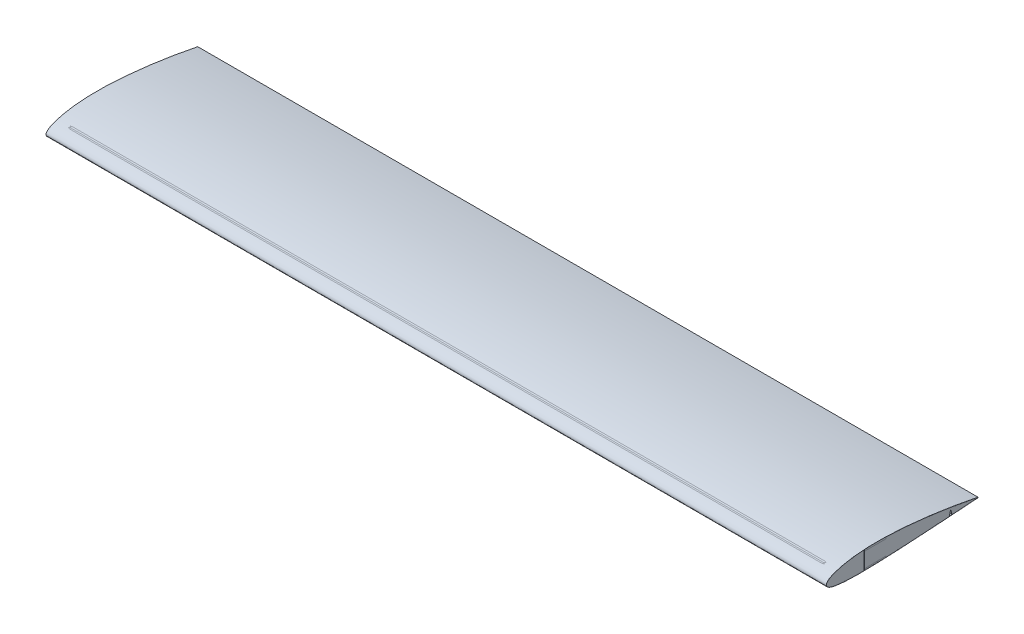
from build123d import *

# Parameters (mm, degrees)
BOSS_EXTRUDE1_DEPTH      = 914.4
SPLIT1_SURFACE_1_1_BACK  = 1864.333
SPLIT1_SURFACE_1_1_DEPTH = 3728.666
SPLIT1_SURFACE_1_2_BACK  = 1864.333
SPLIT1_SURFACE_1_2_DEPTH = 3728.666
SPLIT1_SURFACE_2_3_BACK  = 1864.333
SPLIT1_SURFACE_2_3_DEPTH = 3728.666
SPLIT1_SURFACE_2_4_BACK  = 1864.333
SPLIT1_SURFACE_2_4_DEPTH = 3728.666
CUT_EXTRUDE2_DEPTH       = 1864.047955072
CUT_EXTRUDE2_DEPTH_BACK  = 1864.047955072
SKETCH5_W                = 0.6096
SKETCH5_H                = 41.97587398
BOSS_EXTRUDE3_DEPTH      = 914.4
CUT_EXTRUDE1_DEPTH       = 982.342251229
CUT_EXTRUDE1_DEPTH_BACK  = 982.342251229
CUT_EXTRUDE3_START       = -15.24
SKETCH7_W                = 88.9
SKETCH7_H                = 50.8
SKETCH7_W_2              = 70
SKETCH7_H_2              = 60
CUT_EXTRUDE3_DEPTH       = 30


with BuildPart() as part:
    # Sketch3 → Boss-Extrude1 (new, symmetric)
    with BuildSketch(Plane(origin=(0, 0, 0), x_dir=(0, 0, -1), z_dir=(1, 0, 0))):
        with BuildLine():
            Line((354.482395792, 0.088620593), (354.482404208, -0.088620593))
            add(Edge.make_bspline(
                [(354.482395792, 0.088620593), (352.608228452, 0.482962912), (348.863032635, 1.270987104), (343.239204367, 2.400705172), (337.619234196, 3.501205803), (332.00350741, 4.57336723), (326.39365094, 5.621708723), (320.790955975, 6.647898692), (313.3412437, 7.986206456), (302.217548708, 9.927124821), (289.282248172, 12.069306379), (276.418289617, 14.074375479), (265.490213834, 15.689685159), (251.115583129, 17.697647921), (236.873997635, 19.516706822), (222.782191073, 21.1545078), (212.410278806, 22.282196191), (202.181522544, 23.317263374), (192.106178265, 24.258738007), (182.194355765, 25.104010981), (172.455993609, 25.84914195), (161.366752116, 26.592136123), (149.021873138, 27.260173986), (135.523535242, 27.752901504), (122.520585026, 27.971703259), (110.042618811, 27.912632335), (99.358952427, 27.613925108), (90.383015498, 27.176611302), (83.018255857, 26.691704891), (75.92680001, 26.098801968), (69.115792956, 25.403560206), (62.592086687, 24.612075224), (56.362219308, 23.730740073), (50.432432253, 22.76613435), (44.808681252, 21.725005613), (39.496589414, 20.614286523), (35.273389174, 19.622414223), (31.312122611, 18.607678857), (28.30479813, 17.772072592), (25.414040275, 16.897477013), (23.365017286, 16.242283662), (21.399313086, 15.577802598), (19.517418849, 14.904921007), (17.719798231, 14.224519318), (16.006896794, 13.537442329), (14.379132199, 12.844514757), (12.83689884, 12.146526839), (11.380573945, 11.444212218), (10.010495431, 10.738285126), (8.72699723, 10.029363811), (7.530365935, 9.318048232), (6.420876343, 8.604847497), (5.398771977, 7.890203754), (4.464271107, 7.174487774), (3.617571137, 6.457983471), (2.858851273, 5.740891979), (2.188290996, 5.02331412), (1.606069933, 4.305271505), (1.112414132, 3.586696787), (0.707594428, 2.867468864), (0.392035275, 2.147467241), (0.165980955, 1.426648517), (0.03064104, 0.705108282), (-0.015062322, 0.002321998), (0.0300091, -0.681067808), (0.166233189, -1.342726293), (0.392064116, -1.999419221), (0.707750679, -2.648952207), (1.11267333, -3.289391709), (1.606518652, -3.919009399), (2.188985401, -4.536239368), (2.859837198, -5.139669278), (3.618875057, -5.728012998), (4.465910314, -6.300126202), (5.400751117, -6.855005762), (6.423189663, -7.391813529), (7.532996553, -7.909871987), (8.729927186, -8.408651764), (10.013701883, -8.887797325), (11.38402716, -9.347075258), (12.840573178, -9.786424712), (14.382996464, -10.205871846), (16.010922843, -10.605571954), (17.723957882, -10.985755667), (19.521682855, -11.346729932), (21.403657483, -11.688838297), (23.369418393, -12.012454984), (25.418477351, -12.317982315), (27.550327067, -12.60579833), (29.764437774, -12.876267774), (32.06025868, -13.129726833), (35.281637131, -13.450564772), (39.508953014, -13.807595259), (44.820372176, -14.165273739), (50.443395574, -14.459314626), (56.372426035, -14.689735484), (62.601520751, -14.856376302), (69.124436068, -14.959259527), (75.934620245, -14.999005808), (83.025208132, -14.977114302), (90.389050421, -14.896168064), (98.01873047, -14.759786253), (105.906589977, -14.572414932), (114.044705159, -14.338950875), (122.424896468, -14.064247122), (131.038747414, -13.752531546), (139.877603076, -13.406970238), (148.932577206, -13.029259309), (161.41234267, -12.47716831), (174.14861492, -11.863755741), (187.128161714, -11.181855227), (197.122814271, -10.626100485), (207.275853505, -10.030722137), (219.334002974, -9.289918707), (231.549233078, -8.503762909), (243.909719078, -7.688473483), (254.646983505, -6.974941746), (263.659566191, -6.37740606), (272.749168182, -5.777991417), (281.906666981, -5.177313299), (292.948412975, -4.453461563), (302.190318, -3.838787226), (309.611800723, -3.332601249), (315.195965568, -2.943756386), (320.789989327, -2.54505907), (326.392440618, -2.136294162), (332.001878993, -1.718848953), (337.616855999, -1.295823565), (343.235982568, -0.874824171), (348.857573789, -0.461772871), (352.607516747, -0.21300097), (354.482404208, -0.088620593)],
                knots=[0, 0, 0, 0, 0.007940543, 0.015867786, 0.023782336, 0.031683842, 0.039571466, 0.047443805, 0.055299407, 0.070952907, 0.094259966, 0.109659749, 0.124931368, 0.140060475, 0.169836167, 0.184455938, 0.198878988, 0.213091981, 0.227081364, 0.240833733, 0.254335896, 0.267574898, 0.286913018, 0.305591757, 0.323574751, 0.340828862, 0.357323531, 0.367884026, 0.378086462, 0.387923234, 0.397387015, 0.406470797, 0.41516795, 0.423472244, 0.43137777, 0.438879022, 0.445971139, 0.449362331, 0.455832514, 0.458910652, 0.461883669, 0.464751272, 0.467513247, 0.470169459, 0.472719872, 0.475164567, 0.477503762, 0.479737826, 0.481867333, 0.483893084, 0.485816152, 0.487637951, 0.489360303, 0.49098553, 0.492516542, 0.493957004, 0.495311466, 0.496585561, 0.4977862, 0.498921787, 0.500002352, 0.50103964, 0.502046987, 0.503038995, 0.503951731, 0.504878158, 0.505831393, 0.506823576, 0.507865603, 0.508967032, 0.510136107, 0.511379885, 0.512704371, 0.51411466, 0.515615093, 0.517209348, 0.518900571, 0.520691419, 0.522584144, 0.524580638, 0.526682478, 0.528890964, 0.531207133, 0.533631806, 0.536165599, 0.538808937, 0.541562081, 0.544425147, 0.547398108, 0.550480817, 0.553673027, 0.556974385, 0.563902733, 0.571261381, 0.579045037, 0.58724742, 0.595861595, 0.604880098, 0.614294871, 0.624097261, 0.634278056, 0.644827522, 0.655735355, 0.666990799, 0.678582536, 0.690498843, 0.702727789, 0.715257042, 0.728074047, 0.754520377, 0.768123571, 0.781962351, 0.796022904, 0.810291085, 0.832050541, 0.846772874, 0.861649926, 0.876666219, 0.884221743, 0.899417941, 0.914715475, 0.9300999, 0.937820202, 0.945556969, 0.953308312, 0.961072259, 0.968846879, 0.976629764, 0.984418334, 0.992209516, 1, 1, 1, 1], degree=3))
        make_face()
    extrude(amount=BOSS_EXTRUDE1_DEPTH, both=True)


with BuildPart() as body_2:
    # Split1: the piece behind the surface
    add(part.part)
    # Split1 surface 1: a surface, the sketch's curves swept straight by 3728.666 mm
    with BuildLine(Plane(origin=(914.4, 0, 0), x_dir=(0, 0, -1), z_dir=(1, 0, 0)).offset(-SPLIT1_SURFACE_1_1_BACK), mode=Mode.PRIVATE) as split1_surface_1_1_path:
        Line((139.692248422, -14.02064701), (139.692248422, -10.84564701))
        Line((139.692248422, -10.84564701), (88.9, -11.733059128))
        Line((88.9, -11.733059128), (88.9, -14.908059128))
    split1_surface_1_1 = Shell.extrude(split1_surface_1_1_path.wire(), (1 * SPLIT1_SURFACE_1_1_DEPTH, 0 * SPLIT1_SURFACE_1_1_DEPTH, 0 * SPLIT1_SURFACE_1_1_DEPTH))
    split(bisect_by=split1_surface_1_1, keep=Keep.BOTTOM)


with BuildPart() as part_1:
    add(part.part)

    # Split1: split by a surface, the side it looks to stays
    # Split1 surface 1: a surface, the sketch's curves swept straight by 3728.666 mm
    with BuildLine(Plane(origin=(914.4, 0, 0), x_dir=(0, 0, -1), z_dir=(1, 0, 0)).offset(-SPLIT1_SURFACE_1_2_BACK), mode=Mode.PRIVATE) as split1_surface_1_2_path:
        Line((139.692248422, -14.02064701), (139.692248422, -10.84564701))
        Line((139.692248422, -10.84564701), (88.9, -11.733059128))
        Line((88.9, -11.733059128), (88.9, -14.908059128))
    split1_surface_1_2 = Shell.extrude(split1_surface_1_2_path.wire(), (1 * SPLIT1_SURFACE_1_2_DEPTH, 0 * SPLIT1_SURFACE_1_2_DEPTH, 0 * SPLIT1_SURFACE_1_2_DEPTH))
    split(bisect_by=split1_surface_1_2, keep=Keep.TOP)


with BuildPart() as body_3:
    # Split1 2 body 2: the piece behind the surface
    add(body_2.part)
    # Split1 surface 2: a surface, the sketch's curves swept straight by 3728.666 mm
    with BuildLine(Plane(origin=(914.4, 0, 0), x_dir=(0, 0, -1), z_dir=(1, 0, 0)).offset(-SPLIT1_SURFACE_2_3_BACK), mode=Mode.PRIVATE) as split1_surface_2_3_path:
        Line((139.7, 27.585057341), (139.7, 23.892814852))
        Line((139.7, 23.892814852), (88.9, 23.892814852))
        Line((88.9, 23.892814852), (88.9, 27.067814852))
    split1_surface_2_3 = Shell.extrude(split1_surface_2_3_path.wire(), (1 * SPLIT1_SURFACE_2_3_DEPTH, 0 * SPLIT1_SURFACE_2_3_DEPTH, 0 * SPLIT1_SURFACE_2_3_DEPTH))
    split(bisect_by=split1_surface_2_3, keep=Keep.BOTTOM)


with BuildPart() as body_2_1:
    add(body_2.part)

    # Split1 2 body 2: split by a surface, the side it looks to stays
    # Split1 surface 2: a surface, the sketch's curves swept straight by 3728.666 mm
    with BuildLine(Plane(origin=(914.4, 0, 0), x_dir=(0, 0, -1), z_dir=(1, 0, 0)).offset(-SPLIT1_SURFACE_2_4_BACK), mode=Mode.PRIVATE) as split1_surface_2_4_path:
        Line((139.7, 27.585057341), (139.7, 23.892814852))
        Line((139.7, 23.892814852), (88.9, 23.892814852))
        Line((88.9, 23.892814852), (88.9, 27.067814852))
    split1_surface_2_4 = Shell.extrude(split1_surface_2_4_path.wire(), (1 * SPLIT1_SURFACE_2_4_DEPTH, 0 * SPLIT1_SURFACE_2_4_DEPTH, 0 * SPLIT1_SURFACE_2_4_DEPTH))
    split(bisect_by=split1_surface_2_4, keep=Keep.TOP)

    # Sketch5 → Cut-Extrude2 (cut, two sides: drawn at the far end of the back side and taken through both)
    with BuildSketch(Plane(origin=(914.4, 0, 0), x_dir=(0, 0, -1), z_dir=(1, 0, 0)).offset(-CUT_EXTRUDE2_DEPTH_BACK)):
        with Locations((88.5952, 6.079877862)):
            Rectangle(SKETCH5_W, SKETCH5_H)
    extrude(amount=CUT_EXTRUDE2_DEPTH + CUT_EXTRUDE2_DEPTH_BACK, mode=Mode.SUBTRACT)


with BuildPart() as cut_extrude2_piece_1:
    # of the separate pieces the step leaves, piece 1, a body of its own (cut_extrude2_pieces)
    add(body_2_1.part.solids().sort_by_distance((0, 0.088620593, -354.482395792))[0])

    # Sketch3<3> → Cut-Extrude1 (cut, two sides: drawn at the far end of the back side and taken through both)
    with BuildSketch(Plane(origin=(0, 0, 0), x_dir=(0, 0, -1), z_dir=(1, 0, 0)).offset(-CUT_EXTRUDE1_DEPTH_BACK)):
        Polygon((290.9824, 7.62), (287.654397763, -4.800273435), (290.9824, -6.35), (294.194928457, -4.369319423), align=None)
    extrude(amount=CUT_EXTRUDE1_DEPTH + CUT_EXTRUDE1_DEPTH_BACK, mode=Mode.SUBTRACT)


with BuildPart() as cut_extrude2_piece_2:
    # of the separate pieces the step leaves, piece 2, a body of its own (cut_extrude2_pieces)
    add(body_2_1.part.solids().sort_by_distance((-914.4, 27.030418138, -88.2904))[0])


with BuildPart() as body_5:
    # Sketch3<4> → Boss-Extrude3 (new, symmetric)
    with BuildSketch(Plane(origin=(0, 0, 0), x_dir=(0, 0, -1), z_dir=(1, 0, 0))):
        with BuildLine():
            Line((355.091972301, 0.583307998), (355.0920313, -0.659117779))
            add(Edge.make_bspline(
                [(355.091972301, 0.583307998), (340.312721276, 3.693000498), (310.619909788, 9.275193539), (265.886786743, 16.489468956), (228.423488563, 21.249575809), (198.375428006, 24.346944526), (175.800462925, 26.279897889), (153.185851558, 27.734389131), (130.534341141, 28.566890102), (111.639670243, 28.595066064), (96.53057426, 28.120840782), (85.209090536, 27.490139036), (73.906703798, 26.554481442), (62.635164397, 25.277209771), (51.411056679, 23.609637495), (42.117578054, 21.837331865), (34.74012523, 20.134439319), (29.24437833, 18.69364882), (23.79825163, 17.061014615), (18.420286663, 15.195924919), (13.14366618, 13.032592163), (8.880173336, 10.889148982), (5.630848338, 8.846659986), (3.323741515, 7.086461913), (1.245271009, 5.003310853), (-0.100437746, 2.836873377), (-0.618305265, 0.820016215), (-0.635019423, -0.777298948), (-0.190041233, -2.31532111), (0.846863121, -4.107713514), (2.649273044, -5.870048972), (5.118512155, -7.455426547), (7.737103362, -8.698049302), (11.332776407, -10.034608615), (15.937246254, -11.276874703), (21.529341018, -12.368534166), (27.15473911, -13.195901809), (32.797240174, -13.837752171), (40.333864658, -14.507839139), (49.769089576, -15.075023465), (61.099652807, -15.458479805), (72.432280744, -15.614977761), (83.76344512, -15.594566474), (95.091473866, -15.436956689), (109.964247113, -15.092784384), (122.943936948, -14.66400478), (135.920562744, -14.174609397), (143.690347914, -13.860725655), (157.116288121, -13.285023495), (174.310683531, -12.480653893), (196.927788923, -11.269252396), (227.071310703, -9.442589353), (257.19655476, -7.405393554), (287.324528389, -5.43433642), (309.922117903, -3.947040671), (332.514912298, -2.303371631), (347.562013118, -1.158660561), (355.0920313, -0.659117779)],
                knots=[-0.000683627, -0.000683627, -0.000683627, -0.000683627, 0.06190838, 0.124500386, 0.187092393, 0.218388396, 0.249684399, 0.280980403, 0.312276406, 0.343572409, 0.359220411, 0.374868413, 0.390516414, 0.406164416, 0.421812418, 0.437460419, 0.44528442, 0.453108421, 0.460932422, 0.468756423, 0.476580423, 0.484404424, 0.488316425, 0.492228425, 0.496140425, 0.500052426, 0.502008426, 0.503964426, 0.505920426, 0.507876427, 0.511788427, 0.515700428, 0.519612428, 0.523524428, 0.531348429, 0.53917243, 0.546996431, 0.554820432, 0.562644432, 0.578292434, 0.593940436, 0.609588437, 0.625236439, 0.640884441, 0.656532442, 0.686889741, 0.694713742, 0.710361744, 0.719124449, 0.750420452, 0.781716456, 0.813012459, 0.875604465, 0.906900469, 0.938196472, 0.969492475, 1.000788479, 1.000788479, 1.000788479, 1.000788479], degree=3))
        make_face()
        with BuildLine():
            Line((354.482395792, 0.088620593), (354.482404208, -0.088620593))
            add(Edge.make_bspline(
                [(354.482395792, 0.088620593), (352.608228452, 0.482962912), (348.863032635, 1.270987104), (343.239204367, 2.400705172), (337.619234196, 3.501205803), (332.00350741, 4.57336723), (326.39365094, 5.621708723), (320.790955975, 6.647898692), (313.3412437, 7.986206456), (302.217548708, 9.927124821), (289.282248172, 12.069306379), (276.418289617, 14.074375479), (265.490213834, 15.689685159), (251.115583129, 17.697647921), (236.873997635, 19.516706822), (222.782191073, 21.1545078), (212.410278806, 22.282196191), (202.181522544, 23.317263374), (192.106178265, 24.258738007), (182.194355765, 25.104010981), (172.455993609, 25.84914195), (161.366752116, 26.592136123), (149.021873138, 27.260173986), (135.523535242, 27.752901504), (122.520585026, 27.971703259), (110.042618811, 27.912632335), (99.358952427, 27.613925108), (90.383015498, 27.176611302), (83.018255857, 26.691704891), (75.92680001, 26.098801968), (69.115792956, 25.403560206), (62.592086687, 24.612075224), (56.362219308, 23.730740073), (50.432432253, 22.76613435), (44.808681252, 21.725005613), (39.496589414, 20.614286523), (35.273389174, 19.622414223), (31.312122611, 18.607678857), (28.30479813, 17.772072592), (25.414040275, 16.897477013), (23.365017286, 16.242283662), (21.399313086, 15.577802598), (19.517418849, 14.904921007), (17.719798231, 14.224519318), (16.006896794, 13.537442329), (14.379132199, 12.844514757), (12.83689884, 12.146526839), (11.380573945, 11.444212218), (10.010495431, 10.738285126), (8.72699723, 10.029363811), (7.530365935, 9.318048232), (6.420876343, 8.604847497), (5.398771977, 7.890203754), (4.464271107, 7.174487774), (3.617571137, 6.457983471), (2.858851273, 5.740891979), (2.188290996, 5.02331412), (1.606069933, 4.305271505), (1.112414132, 3.586696787), (0.707594428, 2.867468864), (0.392035275, 2.147467241), (0.165980955, 1.426648517), (0.03064104, 0.705108282), (-0.015062322, 0.002321998), (0.0300091, -0.681067808), (0.166233189, -1.342726293), (0.392064116, -1.999419221), (0.707750679, -2.648952207), (1.11267333, -3.289391709), (1.606518652, -3.919009399), (2.188985401, -4.536239368), (2.859837198, -5.139669278), (3.618875057, -5.728012998), (4.465910314, -6.300126202), (5.400751117, -6.855005762), (6.423189663, -7.391813529), (7.532996553, -7.909871987), (8.729927186, -8.408651764), (10.013701883, -8.887797325), (11.38402716, -9.347075258), (12.840573178, -9.786424712), (14.382996464, -10.205871846), (16.010922843, -10.605571954), (17.723957882, -10.985755667), (19.521682855, -11.346729932), (21.403657483, -11.688838297), (23.369418393, -12.012454984), (25.418477351, -12.317982315), (27.550327067, -12.60579833), (29.764437774, -12.876267774), (32.06025868, -13.129726833), (35.281637131, -13.450564772), (39.508953014, -13.807595259), (44.820372176, -14.165273739), (50.443395574, -14.459314626), (56.372426035, -14.689735484), (62.601520751, -14.856376302), (69.124436068, -14.959259527), (75.934620245, -14.999005808), (83.025208132, -14.977114302), (90.389050421, -14.896168064), (98.01873047, -14.759786253), (105.906589977, -14.572414932), (114.044705159, -14.338950875), (122.424896468, -14.064247122), (131.038747414, -13.752531546), (139.877603076, -13.406970238), (148.932577206, -13.029259309), (161.41234267, -12.47716831), (174.14861492, -11.863755741), (187.128161714, -11.181855227), (197.122814271, -10.626100485), (207.275853505, -10.030722137), (219.334002974, -9.289918707), (231.549233078, -8.503762909), (243.909719078, -7.688473483), (254.646983505, -6.974941746), (263.659566191, -6.37740606), (272.749168182, -5.777991417), (281.906666981, -5.177313299), (292.948412975, -4.453461563), (302.190318, -3.838787226), (309.611800723, -3.332601249), (315.195965568, -2.943756386), (320.789989327, -2.54505907), (326.392440618, -2.136294162), (332.001878993, -1.718848953), (337.616855999, -1.295823565), (343.235982568, -0.874824171), (348.857573789, -0.461772871), (352.607516747, -0.21300097), (354.482404208, -0.088620593)],
                knots=[0, 0, 0, 0, 0.007940543, 0.015867786, 0.023782336, 0.031683842, 0.039571466, 0.047443805, 0.055299407, 0.070952907, 0.094259966, 0.109659749, 0.124931368, 0.140060475, 0.169836167, 0.184455938, 0.198878988, 0.213091981, 0.227081364, 0.240833733, 0.254335896, 0.267574898, 0.286913018, 0.305591757, 0.323574751, 0.340828862, 0.357323531, 0.367884026, 0.378086462, 0.387923234, 0.397387015, 0.406470797, 0.41516795, 0.423472244, 0.43137777, 0.438879022, 0.445971139, 0.449362331, 0.455832514, 0.458910652, 0.461883669, 0.464751272, 0.467513247, 0.470169459, 0.472719872, 0.475164567, 0.477503762, 0.479737826, 0.481867333, 0.483893084, 0.485816152, 0.487637951, 0.489360303, 0.49098553, 0.492516542, 0.493957004, 0.495311466, 0.496585561, 0.4977862, 0.498921787, 0.500002352, 0.50103964, 0.502046987, 0.503038995, 0.503951731, 0.504878158, 0.505831393, 0.506823576, 0.507865603, 0.508967032, 0.510136107, 0.511379885, 0.512704371, 0.51411466, 0.515615093, 0.517209348, 0.518900571, 0.520691419, 0.522584144, 0.524580638, 0.526682478, 0.528890964, 0.531207133, 0.533631806, 0.536165599, 0.538808937, 0.541562081, 0.544425147, 0.547398108, 0.550480817, 0.553673027, 0.556974385, 0.563902733, 0.571261381, 0.579045037, 0.58724742, 0.595861595, 0.604880098, 0.614294871, 0.624097261, 0.634278056, 0.644827522, 0.655735355, 0.666990799, 0.678582536, 0.690498843, 0.702727789, 0.715257042, 0.728074047, 0.754520377, 0.768123571, 0.781962351, 0.796022904, 0.810291085, 0.832050541, 0.846772874, 0.861649926, 0.876666219, 0.884221743, 0.899417941, 0.914715475, 0.9300999, 0.937820202, 0.945556969, 0.953308312, 0.961072259, 0.968846879, 0.976629764, 0.984418334, 0.992209516, 1, 1, 1, 1], degree=3))
        make_face(mode=Mode.SUBTRACT)
    extrude(amount=BOSS_EXTRUDE3_DEPTH, both=True)


with BuildPart() as cut_extrude3_tool:
    # Sketch7 → Cut-Extrude3 (new body)
    with BuildSketch(Plane(origin=(0, 0, 0), x_dir=(1, 0, 0), z_dir=(0, 1, 0)).offset(CUT_EXTRUDE3_START)):
        with Locations((323.85, 165.092248423)):
            Rectangle(SKETCH7_W, SKETCH7_H)
        with Locations((625.4, 169.692248423)):
            Rectangle(SKETCH7_W_2, SKETCH7_H_2)
        with Locations((193.75, 169.692248423)):
            Rectangle(SKETCH7_W_2, SKETCH7_H_2)
        with Locations((-193.75, 169.692248423)):
            Rectangle(SKETCH7_W_2, SKETCH7_H_2)
        with Locations((-323.85, 165.092248423)):
            Rectangle(SKETCH7_W, SKETCH7_H)
        with Locations((-625.4, 169.692248423)):
            Rectangle(SKETCH7_W_2, SKETCH7_H_2)
    extrude(amount=CUT_EXTRUDE3_DEPTH)


with BuildPart() as cut_extrude2_piece_1_1:
    add(cut_extrude2_piece_1.part)

    # Cut-Extrude3: cut by cut_extrude3_tool
    add(cut_extrude3_tool.part, mode=Mode.SUBTRACT)


with BuildPart() as body_5_1:
    add(body_5.part)

    # Cut-Extrude3: cut by cut_extrude3_tool
    add(cut_extrude3_tool.part, mode=Mode.SUBTRACT)


solid = Compound([part_1.part, body_3.part, cut_extrude2_piece_2.part, cut_extrude2_piece_1_1.part, body_5_1.part])
